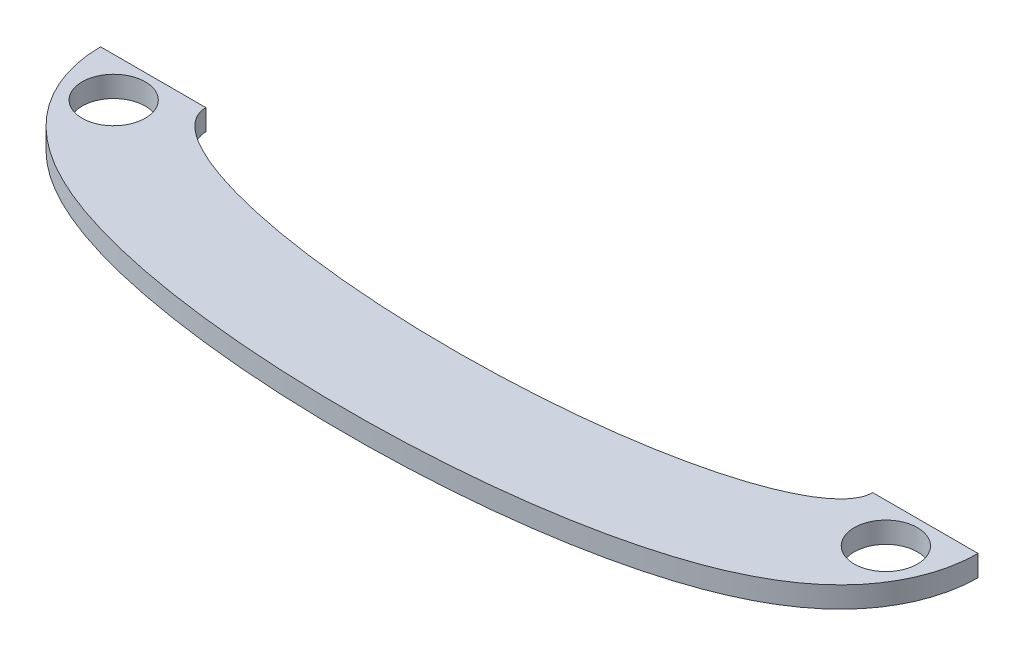
from build123d import *

# Parameters (mm, degrees)
EXTRUDE_THIN1_DEPTH = 1
SKETCH3_R           = 1.5
CUT_EXTRUDE1_DEPTH  = 23.72216596


# Read off the part's stored shape, not the designer's step: Extrude-Thin1
with BuildPart() as part:
    # Extrude-Thin1 outline → Extrude-Thin1 (new body)
    with BuildSketch(Plane(origin=(0, 0, 0), x_dir=(1, 0, 0), z_dir=(0, 1, 0))):
        with BuildLine():
            Line((-15.84, 0.095707317), (-20.84, 0.095707317))
            add(Edge.make_bspline(
                [(-20.84, 0.095707317), (-20.84, -0.287744391), (-20.802894903, -0.670930114), (-20.66315553, -1.40632716), (-20.560892163, -1.758265795), (-20.311421989, -2.413116521), (-20.164538912, -2.716150493), (-19.846308329, -3.270798423), (-19.675048346, -3.522651652), (-19.145333579, -4.211149049), (-18.773004047, -4.581612013), (-18.029422432, -5.215352423), (-17.656406848, -5.479169384), (-16.9069764, -5.946935789), (-16.530007385, -6.150517664), (-15.763532359, -6.521252383), (-15.373924369, -6.688134342), (-14.176437378, -7.151474802), (-13.338740617, -7.411655379), (-11.565467202, -7.870111433), (-10.630473595, -8.067228408), (-8.672264647, -8.405506309), (-7.649358762, -8.546350004), (-4.483607196, -8.885368313), (-2.242662951, -8.999512195), (2.242662951, -8.999512195), (4.483607196, -8.885368313), (7.649358762, -8.546350004), (8.672264647, -8.405506309), (10.630473595, -8.067228408), (11.565467202, -7.870111433), (13.338740617, -7.411655379), (14.176437378, -7.151474802), (15.373924369, -6.688134342), (15.763532359, -6.521252383), (16.530007385, -6.150517664), (16.9069764, -5.946935789), (17.656406848, -5.479169384), (18.029422432, -5.215352423), (18.773004047, -4.581612013), (19.145333579, -4.211149049), (19.675048346, -3.522651652), (19.846308329, -3.270798423), (20.164538912, -2.716150493), (20.311421989, -2.413116521), (20.560892163, -1.758265795), (20.66315553, -1.40632716), (20.802894903, -0.670930114), (20.84, -0.287744391), (20.84, 0.095707317)],
                knots=[0, 0, 0, 0, 0.015625, 0.015625, 0.03125, 0.03125, 0.046875, 0.046875, 0.0625, 0.0625, 0.09375, 0.09375, 0.125, 0.125, 0.15625, 0.15625, 0.1875, 0.1875, 0.25, 0.25, 0.3125, 0.3125, 0.375, 0.375, 0.5, 0.5, 0.625, 0.625, 0.6875, 0.6875, 0.75, 0.75, 0.8125, 0.8125, 0.84375, 0.84375, 0.875, 0.875, 0.90625, 0.90625, 0.9375, 0.9375, 0.953125, 0.953125, 0.96875, 0.96875, 0.984375, 0.984375, 1, 1, 1, 1], degree=3))
            Line((20.84, 0.095707317), (15.84, 0.095707317))
            add(Edge.make_bspline(
                [(-15.84, 0.095707317), (-15.84, -3.999512195), (0, -3.999512195), (15.84, -3.999512195), (15.84, 0.095707317)],
                knots=[3.141592654, 3.141592654, 3.141592654, 4.71238898, 4.71238898, 6.283185307, 6.283185307, 6.283185307], degree=2, weights=[1, 0.707106781, 1, 0.707106781, 1]))
        make_face()
    extrude(amount=EXTRUDE_THIN1_DEPTH)

    # Sketch3 → Cut-Extrude1 (cut, through all)
    with BuildSketch(Plane(origin=(0, 1, 0), x_dir=(1, 0, 0), z_dir=(0, 1, 0))):
        with Locations(Location((-18.34, -1.781989688, 0), (0, 0, 270))):
            Circle(SKETCH3_R)
        with Locations(Location((18.34, -1.781989688, 0), (0, 0, 90))):
            Circle(SKETCH3_R)
    extrude(amount=-CUT_EXTRUDE1_DEPTH, mode=Mode.SUBTRACT)


solid = part.part
